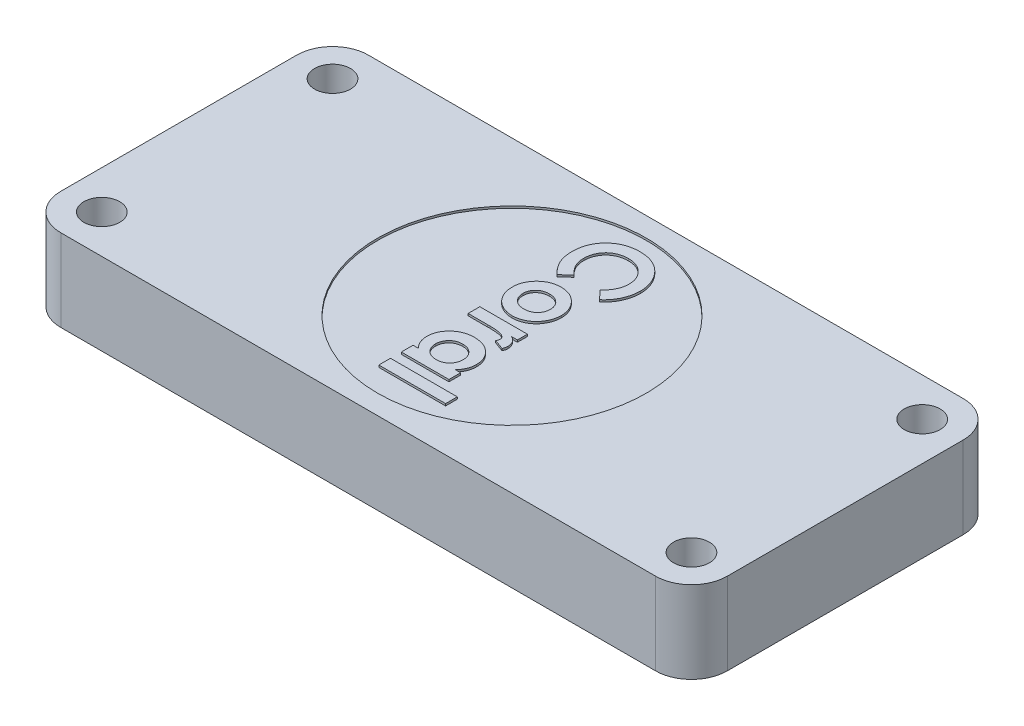
from build123d import *

# Parameters (mm, degrees)
SKETCH1_W           = 65
SKETCH1_H           = 30
SKETCH1_R           = 1.75
BOSS_EXTRUDE1_DEPTH = 8
FILLET1_R           = 3.5
SKETCH2_R           = 13.103694402
SKETCH2_W           = 6.512820512
SKETCH2_H           = 1.13974359
CUT_EXTRUDE1_DEPTH  = 0.2


with BuildPart() as part:
    # Sketch1 → Boss-Extrude1 (new body)
    with BuildSketch(Plane(origin=(0, 0, 0), x_dir=(1, 0, 0), z_dir=(0, 1, 0))):
        Rectangle(SKETCH1_W, SKETCH1_H)
        with Locations((-28.75, 11.25)):
            Circle(SKETCH1_R, mode=Mode.SUBTRACT)
        with Locations((-28.75, -11.25)):
            Circle(SKETCH1_R, mode=Mode.SUBTRACT)
        with Locations((28.75, 11.25)):
            Circle(SKETCH1_R, mode=Mode.SUBTRACT)
        with Locations((28.75, -11.25)):
            Circle(SKETCH1_R, mode=Mode.SUBTRACT)
    extrude(amount=BOSS_EXTRUDE1_DEPTH)

    # Fillet1
    fillet1_edges = [part.edges().sort_by_distance(p)[0] for p in [
        (-32.5, 4, -15),
        (32.5, 4, -15),
        (32.5, 4, 15),
        (-32.5, 4, 15),
    ]]
    fillet(fillet1_edges, radius=FILLET1_R)

    # Sketch2 → Cut-Extrude1 (cut)
    # profile 1 of 3: a face of its own
    with BuildSketch(Plane(origin=(0, 8, 0), x_dir=(1, 0, 0), z_dir=(0, 1, 0))):
        Circle(SKETCH2_R)
        with BuildLine():
            Line((1.793569712, -7.326923077), (2.316376202, -7.326923077))
            Line((2.316376202, -7.326923077), (2.316376202, -8.466666667))
            Line((2.316376202, -8.466666667), (-2.324008413, -8.466666667))
            Line((-2.324008413, -8.466666667), (-2.324008413, -7.326923077))
            Line((-2.324008413, -7.326923077), (-1.817738381, -7.326923077))
            add(Edge.make_bspline(
                [(-1.817738381, -7.326923077), (-1.915117736, -7.219105365), (-2.048735672, -7.052868149), (-2.189096918, -6.814912643), (-2.270669293, -6.640399629), (-2.330810421, -6.461831998), (-2.3899556, -6.213440936), (-2.404545398, -6.019774106), (-2.40541867, -5.889523237)],
                knots=[0, 0, 0, 0, 0.273943506, 0.399987178, 0.519718967, 0.636176176, 0.754371141, 1, 1, 1, 1], degree=3))
            add(Edge.make_bspline(
                [(-2.40541867, -5.889523237), (-2.406995335, -5.742600806), (-2.384504248, -5.524784777), (-2.31232767, -5.244598938), (-2.237070707, -5.044044492), (-2.139399027, -4.851439723), (-2.022018594, -4.665309745), (-1.880765258, -4.488845663), (-1.721762525, -4.320578271), (-1.546857626, -4.166514066), (-1.358479041, -4.031828208), (-1.159298606, -3.918303431), (-0.949975462, -3.825278683), (-0.730668115, -3.752177446), (-0.41942263, -3.681277763), (-0.176555831, -3.664019756), (-0.012720353, -3.663461538)],
                knots=[0, 0, 0, 0, 0.121092325, 0.179634237, 0.238303512, 0.297437091, 0.357506849, 0.419513154, 0.483600041, 0.548295031, 0.611486872, 0.674312645, 0.737107248, 0.800159515, 0.864737133, 1, 1, 1, 1], degree=3))
            add(Edge.make_bspline(
                [(-0.012720353, -3.663461538), (0.156045959, -3.664802024), (0.406094287, -3.680034509), (0.726104406, -3.749794942), (0.949834735, -3.81955033), (1.161646727, -3.909354378), (1.361880786, -4.018710839), (1.550015217, -4.14912783), (1.722847562, -4.29940901), (1.881256251, -4.46167608), (2.019165448, -4.635273155), (2.136319018, -4.817485286), (2.231986205, -5.008507441), (2.305823445, -5.208307322), (2.379064737, -5.488525244), (2.39792752, -5.707710857), (2.397786458, -5.855178285)],
                knots=[0, 0, 0, 0, 0.139308968, 0.205473642, 0.26959838, 0.332253223, 0.394830003, 0.45737553, 0.520581844, 0.583374035, 0.644082429, 0.703039519, 0.761664045, 0.819843943, 0.878346403, 1, 1, 1, 1], degree=3))
            add(Edge.make_bspline(
                [(2.397786458, -5.855178285), (2.399385687, -5.99221338), (2.379105816, -6.195379182), (2.315794611, -6.45799979), (2.249311548, -6.646153515), (2.165150347, -6.82864604), (2.022986959, -7.063957964), (1.891940994, -7.226659369), (1.793569712, -7.326923077)],
                knots=[0, 0, 0, 0, 0.251537451, 0.373434128, 0.49566655, 0.617680221, 0.742091207, 1, 1, 1, 1], degree=3))
        make_face(mode=Mode.SUBTRACT)
        with Locations((0.932401843, -10.094871795)):
            Rectangle(SKETCH2_W, SKETCH2_H, mode=Mode.SUBTRACT)
        with BuildLine():
            Line((-2.324008413, -0.814102564), (2.316376202, -0.814102564))
            Line((2.316376202, -0.814102564), (2.316376202, -1.791025641))
            Line((2.316376202, -1.791025641), (1.745232372, -1.791025641))
            add(Edge.make_bspline(
                [(1.745232372, -1.791025641), (1.845220751, -1.842556491), (1.987806121, -1.930402954), (2.140497806, -2.085938373), (2.234016922, -2.210563371), (2.306771724, -2.34629825), (2.37674953, -2.537873243), (2.398932443, -2.690200201), (2.397786458, -2.792117388)],
                knots=[0, 0, 0, 0, 0.268422379, 0.39320538, 0.516430377, 0.637792883, 0.758061252, 1, 1, 1, 1], degree=3))
            add(Edge.make_bspline(
                [(2.397786458, -2.792117388), (2.396060909, -2.868115109), (2.378737278, -3.029329585), (2.317690019, -3.179598757), (2.283303285, -3.256410256)],
                knots=[0, 0, 0, 0, 0.474167851, 1, 1, 1, 1], degree=3))
            Line((2.283303285, -3.256410256), (1.317828526, -2.902784455))
            add(Edge.make_bspline(
                [(1.317828526, -2.902784455), (1.346269587, -2.843494492), (1.397393829, -2.738868824), (1.420282537, -2.624407485), (1.420863381, -2.574599359)],
                knots=[0, 0, 0, 0, 0.570645018, 1, 1, 1, 1], degree=3))
            add(Edge.make_bspline(
                [(1.420863381, -2.574599359), (1.420806703, -2.532059477), (1.411399745, -2.466882792), (1.374533722, -2.387768586), (1.339310877, -2.329211959), (1.290279658, -2.276078498), (1.233534653, -2.222979308), (1.163469903, -2.176185064), (1.085485809, -2.12680369), (0.990032841, -2.084757242), (0.876081832, -2.048703425), (0.742314078, -2.016580554), (0.588019524, -1.994469651), (0.414690659, -1.973126548), (0.143596749, -1.955180696), (-0.069853668, -1.949027146), (-0.218790064, -1.950030048)],
                knots=[0, 0, 0, 0, 0.066912404, 0.101140702, 0.136380892, 0.173597996, 0.214075626, 0.25797978, 0.305417223, 0.358684712, 0.420923911, 0.492691001, 0.574130849, 0.665182153, 0.766512664, 1, 1, 1, 1], degree=3))
            Line((-0.218790064, -1.950030048), (-0.44521234, -1.953846154))
            Line((-0.44521234, -1.953846154), (-2.324008413, -1.953846154))
            Line((-2.324008413, -1.953846154), (-2.324008413, -0.814102564))
        make_face(mode=Mode.SUBTRACT)
        with BuildLine():
            add(Edge.make_bspline(
                [(1.775761218, 4.015815304), (1.877612424, 3.905167025), (2.011792511, 3.726614171), (2.157280012, 3.471233194), (2.24615025, 3.275709153), (2.313008872, 3.072898694), (2.378786976, 2.792331554), (2.397170862, 2.575294863), (2.397786458, 2.42958734)],
                knots=[0, 0, 0, 0, 0.25846437, 0.382579777, 0.504990606, 0.627227493, 0.749296729, 1, 1, 1, 1], degree=3))
            add(Edge.make_bspline(
                [(2.397786458, 2.42958734), (2.397773344, 2.322903773), (2.388066956, 2.16322058), (2.353297812, 1.953882401), (2.319940824, 1.79960193), (2.27313793, 1.648634299), (2.217020337, 1.500188789), (2.152586786, 1.352937817), (2.07588944, 1.210536201), (1.992703892, 1.071955175), (1.900943483, 0.940572115), (1.801328872, 0.817478067), (1.696169724, 0.700387986), (1.580887748, 0.59475846), (1.461037714, 0.493839188), (1.332325813, 0.403082622), (1.197888459, 0.319055026), (1.058503063, 0.244246194), (0.915139292, 0.179287262), (0.769779062, 0.122913525), (0.620652484, 0.078757698), (0.4697234, 0.042262422), (0.262666443, 0.011113871), (0.105541426, -0.000624242), (0, 0)],
                knots=[0, 0, 0, 0, 0.084364343, 0.126142289, 0.167705805, 0.209066008, 0.25097289, 0.293148456, 0.336041456, 0.37876116, 0.420892731, 0.462622223, 0.503914433, 0.545187585, 0.586138136, 0.627721928, 0.669584534, 0.711432369, 0.752690541, 0.793970501, 0.834591739, 0.875576584, 0.916639513, 1, 1, 1, 1], degree=3))
            add(Edge.make_bspline(
                [(0, 0), (-0.106248238, 0.000139387), (-0.265116701, 0.009616766), (-0.47316723, 0.044485907), (-0.62657709, 0.077972911), (-0.776131374, 0.12460024), (-0.924033196, 0.179065062), (-1.068266966, 0.245926761), (-1.21040604, 0.319846295), (-1.346267725, 0.404414133), (-1.476269008, 0.495092144), (-1.596999347, 0.595588715), (-1.712202926, 0.700372648), (-1.817984073, 0.814414087), (-1.9160604, 0.935892717), (-2.007630905, 1.06375687), (-2.090547277, 1.198926023), (-2.163402632, 1.339668893), (-2.229088812, 1.483611847), (-2.283773105, 1.631596699), (-2.328382091, 1.783316755), (-2.362863969, 1.938865649), (-2.394615089, 2.152474293), (-2.405971679, 2.315182718), (-2.40541867, 2.424499199)],
                knots=[0, 0, 0, 0, 0.083839067, 0.125192329, 0.166335368, 0.207601958, 0.248670144, 0.290582404, 0.332926248, 0.374978427, 0.416740924, 0.457856759, 0.498808992, 0.539515963, 0.580420356, 0.621910028, 0.663502052, 0.705394285, 0.746863727, 0.788245389, 0.82973641, 0.871532383, 0.913824669, 1, 1, 1, 1], degree=3))
            add(Edge.make_bspline(
                [(-2.40541867, 2.424499199), (-2.403821135, 2.583285211), (-2.385877628, 2.819786411), (-2.311356413, 3.12321), (-2.234723971, 3.339294453), (-2.13642866, 3.546822244), (-2.014797737, 3.743976122), (-1.872199635, 3.932718851), (-1.709846752, 4.109780955), (-1.531730505, 4.271993441), (-1.341592514, 4.413707044), (-1.142282952, 4.534028), (-0.933572862, 4.63287396), (-0.71518242, 4.709090336), (-0.407990513, 4.783798649), (-0.168520779, 4.801651136), (-0.007632212, 4.803205128)],
                knots=[0, 0, 0, 0, 0.126883986, 0.188200706, 0.248894086, 0.309598788, 0.371125298, 0.433465539, 0.498143129, 0.562592753, 0.625474489, 0.687114454, 0.748124994, 0.809456656, 0.871431117, 1, 1, 1, 1], degree=3))
            add(Edge.make_bspline(
                [(-0.007632212, 4.803205128), (0.164241203, 4.802936313), (0.41875111, 4.779736647), (0.744888514, 4.697212172), (0.974697824, 4.610192474), (1.19346598, 4.498832871), (1.474027124, 4.315496038), (1.660200467, 4.141625852), (1.775761218, 4.015815304)],
                knots=[0, 0, 0, 0, 0.256473689, 0.3792365, 0.500977689, 0.622366534, 0.744855131, 1, 1, 1, 1], degree=3))
        make_face(mode=Mode.SUBTRACT)
        with BuildLine():
            add(Edge.make_bspline(
                [(4.188812099, 8.326742788), (4.18893928, 8.199278713), (4.178639511, 8.008968181), (4.145000479, 7.757165377), (4.107331929, 7.571080942), (4.062552649, 7.385857795), (4.003938383, 7.20392949), (3.938597472, 7.022426151), (3.860497008, 6.844194308), (3.775242879, 6.668985361), (3.678519467, 6.500903198), (3.576277074, 6.337128185), (3.462471621, 6.181280406), (3.34120512, 6.030474623), (3.168053114, 5.836002635), (3.023707646, 5.702842213), (2.924409054, 5.617307692)],
                knots=[0, 0, 0, 0, 0.123904062, 0.185067241, 0.246840152, 0.30843533, 0.370241251, 0.432586589, 0.495924582, 0.559351071, 0.621942654, 0.684392867, 0.746985808, 0.809441465, 0.872507833, 1, 1, 1, 1], degree=3))
            Line((2.924409054, 5.617307692), (2.125570913, 6.453034856))
            add(Edge.make_bspline(
                [(2.125570913, 6.453034856), (2.270544811, 6.589015725), (2.474336548, 6.800961027), (2.689567452, 7.117633668), (2.822678529, 7.354047813), (2.92321409, 7.599171541), (3.021832779, 7.934609668), (3.049394057, 8.196549275), (3.04906851, 8.371264022)],
                knots=[0, 0, 0, 0, 0.272304448, 0.399525336, 0.522810878, 0.642662717, 0.761022621, 1, 1, 1, 1], degree=3))
            add(Edge.make_bspline(
                [(3.04906851, 8.371264022), (3.048036764, 8.516024709), (3.031411266, 8.731009319), (2.96354227, 9.006002515), (2.894662328, 9.201005753), (2.805445184, 9.386890371), (2.69605268, 9.5640407), (2.567447887, 9.732021406), (2.420302986, 9.888613279), (2.259535715, 10.031857712), (2.087997448, 10.158424488), (1.906081429, 10.264440114), (1.715628547, 10.351461459), (1.515762765, 10.419187845), (1.23287251, 10.484906656), (1.012193438, 10.500326903), (0.863711939, 10.501923077)],
                knots=[0, 0, 0, 0, 0.127706968, 0.188882163, 0.249158299, 0.309661029, 0.370224886, 0.432332222, 0.495781859, 0.559304077, 0.621860558, 0.683321537, 0.744522975, 0.806088371, 0.868994315, 1, 1, 1, 1], degree=3))
            add(Edge.make_bspline(
                [(0.863711939, 10.501923077), (0.759206696, 10.502427776), (0.60407157, 10.494491057), (0.401536113, 10.465612962), (0.256352994, 10.43487529), (0.1158728, 10.396387489), (-0.021115922, 10.351244904), (-0.152720417, 10.294610743), (-0.280469154, 10.231746803), (-0.400876357, 10.158636535), (-0.515694618, 10.079810237), (-0.624361109, 9.994335971), (-0.726431598, 9.901660134), (-0.820310951, 9.800478423), (-0.90882224, 9.693406013), (-0.989749696, 9.578636739), (-1.065124402, 9.458554654), (-1.130602708, 9.332122385), (-1.189914691, 9.202770392), (-1.23808013, 9.068537214), (-1.27692352, 8.931058051), (-1.309886906, 8.790821085), (-1.337481449, 8.596875468), (-1.348880386, 8.44924497), (-1.347085337, 8.349639423)],
                knots=[0, 0, 0, 0, 0.090639062, 0.134485273, 0.177331356, 0.219264833, 0.260785002, 0.302316572, 0.343435729, 0.384181474, 0.424375739, 0.464181122, 0.504011983, 0.543822462, 0.583802465, 0.624418535, 0.66554756, 0.70667494, 0.747826979, 0.788895117, 0.830219358, 0.871706937, 0.913733854, 1, 1, 1, 1], degree=3))
            add(Edge.make_bspline(
                [(-1.347085337, 8.349639423), (-1.346463629, 8.182916819), (-1.324283414, 7.935120966), (-1.239897428, 7.619515948), (-1.166645404, 7.433045795), (-1.094224556, 7.286948907), (-1.027250735, 7.175727573), (-0.95232872, 7.060717199), (-0.8666411, 6.943821811), (-0.77118892, 6.823752368), (-0.624453233, 6.657814836), (-0.50704784, 6.534182518), (-0.42358774, 6.453034856)],
                knots=[0, 0, 0, 0, 0.229969726, 0.340703508, 0.449355147, 0.505556512, 0.56530267, 0.628204956, 0.694728992, 0.765018834, 0.839580202, 1, 1, 1, 1], degree=3))
            Line((-0.42358774, 6.453034856), (-1.274579327, 5.642748397))
            add(Edge.make_bspline(
                [(-1.274579327, 5.642748397), (-1.381938819, 5.75376993), (-1.539177816, 5.917256717), (-1.72625556, 6.146067386), (-1.852725058, 6.309295362), (-1.965028432, 6.470943324), (-2.063278593, 6.630989995), (-2.14996022, 6.787624604), (-2.223611597, 6.94409946), (-2.286149047, 7.101388298), (-2.339990499, 7.263220018), (-2.385535324, 7.430089393), (-2.422295811, 7.603015449), (-2.451727391, 7.780385763), (-2.47876441, 8.027965297), (-2.487581948, 8.216729622), (-2.486828926, 8.344551282)],
                knots=[0, 0, 0, 0, 0.151815657, 0.222539839, 0.290277535, 0.354640607, 0.415797753, 0.474709008, 0.5304261, 0.585579746, 0.640906165, 0.697901091, 0.755420321, 0.814521258, 0.874461831, 1, 1, 1, 1], degree=3))
            add(Edge.make_bspline(
                [(-2.486828926, 8.344551282), (-2.485407305, 8.576064045), (-2.460811056, 8.918659681), (-2.360687505, 9.356930222), (-2.256993365, 9.663333067), (-2.124399726, 9.953439425), (-1.961879029, 10.227168486), (-1.76982772, 10.484080748), (-1.550506289, 10.722100614), (-1.308283601, 10.937400306), (-1.048202979, 11.127702603), (-0.768986325, 11.285112235), (-0.474757531, 11.415844517), (-0.164178017, 11.517955843), (0.280132838, 11.616141656), (0.626587725, 11.642120162), (0.861167869, 11.641666667)],
                knots=[0, 0, 0, 0, 0.131836579, 0.194461068, 0.255345968, 0.31558834, 0.375627452, 0.436137852, 0.49777862, 0.559470361, 0.62027777, 0.680787689, 0.741491622, 0.803215436, 0.866492763, 1, 1, 1, 1], degree=3))
            add(Edge.make_bspline(
                [(0.861167869, 11.641666667), (1.015981783, 11.643008743), (1.24450499, 11.62762944), (1.5440518, 11.586339476), (1.758185007, 11.538226112), (1.967155075, 11.480132902), (2.168693631, 11.407912517), (2.363379156, 11.321652587), (2.551537767, 11.22414076), (2.73193677, 11.113826154), (2.903026267, 10.990592748), (3.066127035, 10.857612913), (3.21907524, 10.711691396), (3.363213796, 10.55494862), (3.497761593, 10.386676911), (3.624648177, 10.207888339), (3.740601531, 10.018098985), (3.845487275, 9.820995971), (3.938001815, 9.619065212), (4.015319611, 9.412803096), (4.079463181, 9.203080722), (4.127300543, 8.989015728), (4.176094506, 8.698007977), (4.187181091, 8.475380047), (4.188812099, 8.326742788)],
                knots=[0, 0, 0, 0, 0.088511806, 0.130925591, 0.172904037, 0.21400012, 0.25498502, 0.295291276, 0.335772442, 0.376180821, 0.416178408, 0.456350051, 0.496512167, 0.537040574, 0.578118744, 0.619724561, 0.66242197, 0.705298954, 0.747430001, 0.789432984, 0.831267421, 0.872825096, 0.91487011, 1, 1, 1, 1], degree=3))
        make_face(mode=Mode.SUBTRACT)
    # profile 2 of 3: a face of its own
    with BuildSketch(Plane(origin=(0, 8, 0), x_dir=(1, 0, 0), z_dir=(0, 1, 0))):
        with BuildLine():
            add(Edge.make_bspline(
                [(0.002544071, 1.13974359), (0.09744292, 1.139356578), (0.237253352, 1.149042514), (0.416393634, 1.18674959), (0.540492308, 1.22679371), (0.65838308, 1.276275114), (0.769461011, 1.337373669), (0.873179397, 1.410729126), (0.969023878, 1.493889622), (1.05547039, 1.585864931), (1.132560114, 1.683431952), (1.196317716, 1.788821377), (1.248882409, 1.900057658), (1.289302223, 2.017430533), (1.330065509, 2.184635867), (1.337554128, 2.315782603), (1.339453125, 2.404146635)],
                knots=[0, 0, 0, 0, 0.137840339, 0.202697511, 0.265405501, 0.326938422, 0.388125269, 0.449116585, 0.511100798, 0.572085896, 0.632197341, 0.691338952, 0.750563856, 0.810545842, 0.871334761, 1, 1, 1, 1], degree=3))
            add(Edge.make_bspline(
                [(1.339453125, 2.404146635), (1.337115252, 2.49070307), (1.330884888, 2.620202586), (1.287839293, 2.783953713), (1.2474632, 2.900360542), (1.193449035, 3.010188445), (1.130244061, 3.116435684), (1.051149659, 3.213580135), (0.964389175, 3.306322351), (0.868043897, 3.390511301), (0.763075842, 3.462249543), (0.653500697, 3.526344501), (0.535307337, 3.574961849), (0.411724254, 3.615129721), (0.234181227, 3.652328959), (0.096383736, 3.665037337), (0.002544071, 3.663461538)],
                knots=[0, 0, 0, 0, 0.126802865, 0.187422712, 0.246517508, 0.306285303, 0.365703059, 0.4264774, 0.488621826, 0.550895458, 0.612678531, 0.673914015, 0.735734248, 0.798735035, 0.86329015, 1, 1, 1, 1], degree=3))
            add(Edge.make_bspline(
                [(0.002544071, 3.663461538), (-0.09360549, 3.66384808), (-0.235156486, 3.654349364), (-0.416726411, 3.616221873), (-0.542678813, 3.576687664), (-0.662164917, 3.526910629), (-0.774512332, 3.465854222), (-0.879046064, 3.392858769), (-0.975637297, 3.310100578), (-1.063314101, 3.219483673), (-1.138555534, 3.120192727), (-1.20392858, 3.016386008), (-1.256439683, 2.905669728), (-1.296958346, 2.789622102), (-1.337543848, 2.624501657), (-1.345371286, 2.495084849), (-1.347085337, 2.40796274)],
                knots=[0, 0, 0, 0, 0.139455827, 0.204809025, 0.268587499, 0.330586987, 0.392213478, 0.453609543, 0.515091734, 0.576401551, 0.636039465, 0.695407414, 0.753980593, 0.813284842, 0.873377339, 1, 1, 1, 1], degree=3))
            add(Edge.make_bspline(
                [(-1.347085337, 2.40796274), (-1.346800068, 2.320580503), (-1.335431396, 2.191196091), (-1.295959625, 2.02541106), (-1.25511353, 1.908369232), (-1.201472814, 1.797583874), (-1.135788548, 1.692631777), (-1.059500153, 1.592589455), (-0.970169174, 1.500756421), (-0.873276665, 1.415748679), (-0.768191155, 1.34120071), (-0.65584356, 1.278910287), (-0.536941178, 1.227803456), (-0.41164599, 1.188209713), (-0.232095585, 1.150700577), (-0.092540769, 1.13814623), (0.002544071, 1.13974359)],
                knots=[0, 0, 0, 0, 0.126396675, 0.18693923, 0.24609921, 0.305348133, 0.364571657, 0.424924428, 0.486952233, 0.549550456, 0.611149272, 0.672921868, 0.735010283, 0.798048595, 0.862642915, 1, 1, 1, 1], degree=3))
        make_face()
    # profile 3 of 3: a face of its own
    with BuildSketch(Plane(origin=(0, 8, 0), x_dir=(1, 0, 0), z_dir=(0, 1, 0))):
        with BuildLine():
            add(Edge.make_bspline(
                [(0.008904247, -7.408333333), (0.103225881, -7.406690306), (0.243065139, -7.398794803), (0.42184693, -7.358362145), (0.546492816, -7.318177297), (0.664014, -7.265561182), (0.77310241, -7.199785848), (0.877538866, -7.125154842), (0.971477141, -7.036916765), (1.058751493, -6.942189603), (1.133365521, -6.838793522), (1.197668206, -6.729986439), (1.250469679, -6.615098266), (1.289151004, -6.493071193), (1.329958119, -6.320549468), (1.337792787, -6.185233617), (1.339453125, -6.094320913)],
                knots=[0, 0, 0, 0, 0.135095843, 0.199062931, 0.26154836, 0.322044302, 0.382646423, 0.443384787, 0.505154721, 0.566515904, 0.627254268, 0.687026267, 0.746970113, 0.807538884, 0.869732605, 1, 1, 1, 1], degree=3))
            add(Edge.make_bspline(
                [(1.339453125, -6.094320913), (1.33805364, -6.005415524), (1.329274417, -5.873348466), (1.28993282, -5.703885148), (1.24719503, -5.58547419), (1.195096418, -5.47198713), (1.129853959, -5.365150512), (1.052736129, -5.26408173), (0.965612861, -5.169375378), (0.869848302, -5.08303667), (0.765348366, -5.008607312), (0.654929151, -4.945355702), (0.538256883, -4.891856338), (0.413957811, -4.853581276), (0.237262099, -4.812386131), (0.098489211, -4.805229746), (0.005088141, -4.803205128)],
                knots=[0, 0, 0, 0, 0.128420809, 0.189995948, 0.250359009, 0.30974405, 0.369855539, 0.430536995, 0.492876096, 0.555257199, 0.616197084, 0.67757746, 0.738630831, 0.800921896, 0.864881541, 1, 1, 1, 1], degree=3))
            add(Edge.make_bspline(
                [(0.005088141, -4.803205128), (-0.089269882, -4.804895074), (-0.228974478, -4.813028297), (-0.408133043, -4.852748911), (-0.532948652, -4.89538034), (-0.652048706, -4.947474445), (-0.764879588, -5.010876517), (-0.869447322, -5.088757049), (-0.968226152, -5.17517141), (-1.056431543, -5.271820666), (-1.134750859, -5.373461293), (-1.200276886, -5.48148168), (-1.253249012, -5.59470982), (-1.296366125, -5.712764778), (-1.335168052, -5.880645682), (-1.34669767, -6.011153359), (-1.347085337, -6.099409054)],
                knots=[0, 0, 0, 0, 0.135364742, 0.199460916, 0.262263612, 0.323991109, 0.385461119, 0.447170687, 0.510418175, 0.573170928, 0.634270788, 0.693953647, 0.753722967, 0.813083582, 0.873628543, 1, 1, 1, 1], degree=3))
            add(Edge.make_bspline(
                [(-1.347085337, -6.099409054), (-1.345579608, -6.18998759), (-1.337120111, -6.32419763), (-1.297586473, -6.496193234), (-1.254601848, -6.616194288), (-1.202877645, -6.731249593), (-1.138909958, -6.840317293), (-1.061969133, -6.942214779), (-0.974058257, -7.037457901), (-0.877511719, -7.124729754), (-0.771641459, -7.200188476), (-0.659833764, -7.265914139), (-0.539443891, -7.317610452), (-0.412582704, -7.358641191), (-0.230270339, -7.398774405), (-0.087540149, -7.40659951), (0.008904247, -7.408333333)],
                knots=[0, 0, 0, 0, 0.128661741, 0.189789734, 0.249707447, 0.309188905, 0.368499841, 0.428643518, 0.489936978, 0.552121002, 0.612878024, 0.674050383, 0.735729182, 0.798304624, 0.862952782, 1, 1, 1, 1], degree=3))
        make_face()
    extrude(amount=-CUT_EXTRUDE1_DEPTH, mode=Mode.SUBTRACT)


solid = part.part
